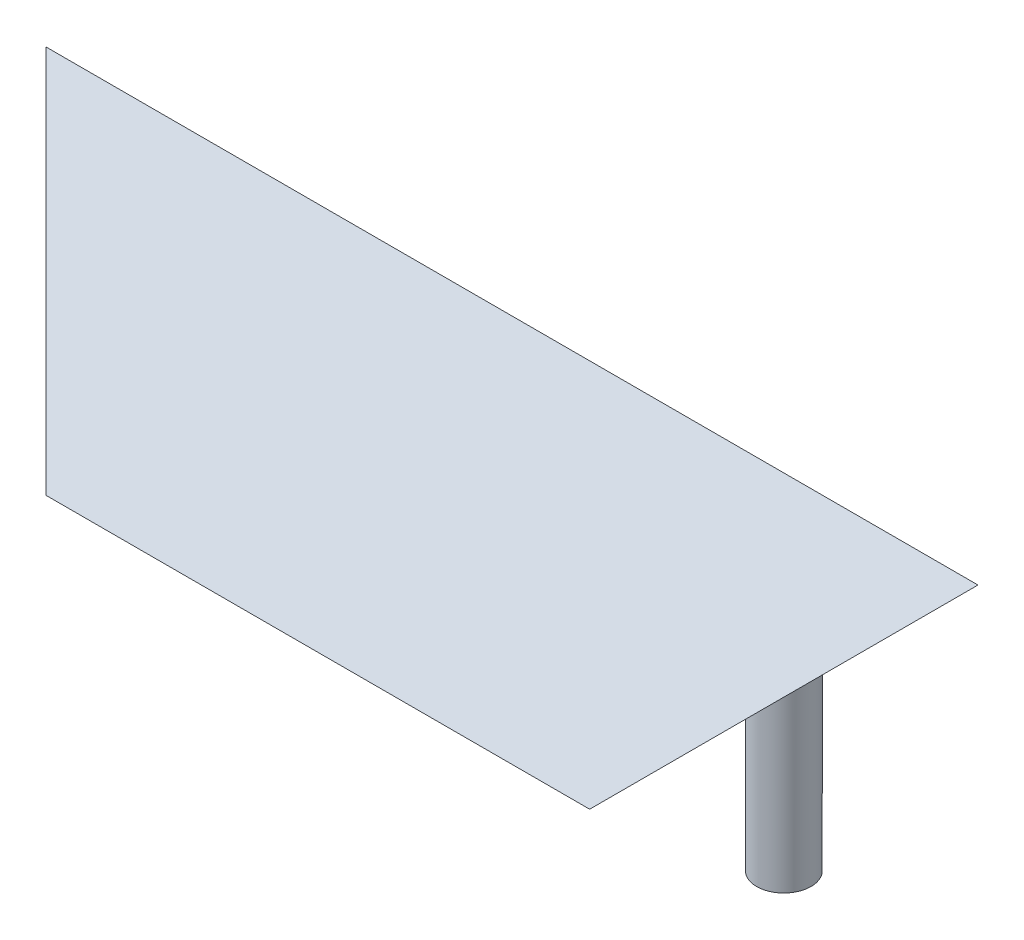
from build123d import *

# Parameters (mm, degrees)
BOSS_EXTRUDE1_DEPTH = 10
CHAMFER1_SIZE       = 10
BOSS_EXTRUDE2_START = -10
SKETCH2_R           = 1.4
BOSS_EXTRUDE2_DEPTH = 14.75
CUT_EXTRUDE1_DEPTH  = 5


with BuildPart() as part:
    # Sketch1 → Boss-Extrude1 (new body)
    with BuildSketch(Plane.XY):
        Polygon((0, 0), (28, 0), (38, 10), (-10, 10), align=None)
    extrude(amount=BOSS_EXTRUDE1_DEPTH)

    # Chamfer1
    chamfer1_edges = [part.edges().sort_by_distance(p)[0] for p in [
        (14, 10, 10),
    ]]
    chamfer(chamfer1_edges, length=CHAMFER1_SIZE - 0.0001)  # a hair under: the kernel refuses the full size

    # Sketch2 → Boss-Extrude2 (add)
    with BuildSketch(Plane.XZ.offset(BOSS_EXTRUDE2_START)):
        with Locations(Location((31, 3, 0), (0, 0, 270))):
            Circle(SKETCH2_R)
        with Locations(Location((-3, 3, 0), (0, 0, 90))):
            Circle(SKETCH2_R)
    extrude(amount=BOSS_EXTRUDE2_DEPTH)

    # Sketch4 → Cut-Extrude1 (cut)
    with BuildSketch(Plane(origin=(0, 5, 5), x_dir=(1, 0, 0), z_dir=(0, 0.7071067811865487, 0.7071067811865465))):
        Polygon((-10, 7.071067812), (0, -7.071067812), (28, -7.071067812), (38, 7.071067812), align=None)
    extrude(amount=CUT_EXTRUDE1_DEPTH, mode=Mode.SUBTRACT)


solid = part.part
